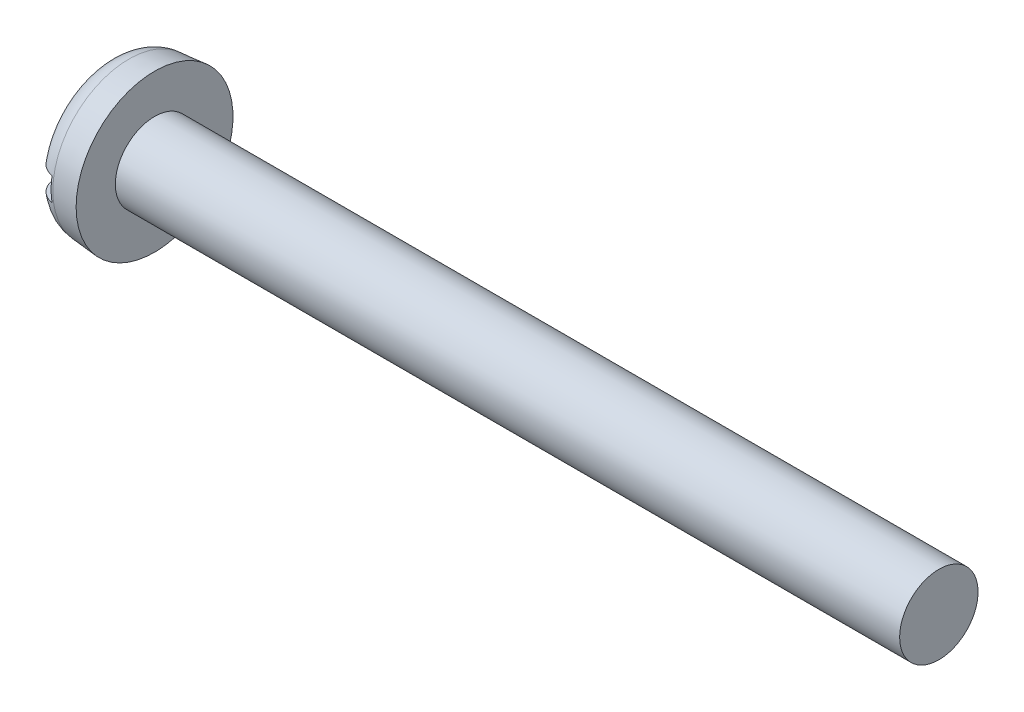
from build123d import *

# Parameters (mm, degrees)
FILLET2_R  = 1.2
SKETCH2_W  = 8
SKETCH2_H  = 1.2
SLOT_DEPTH = 1


with BuildPart() as part:
    # BodySke → Base-Revolve (revolve)
    with BuildSketch(Plane.XY):
        Polygon((2.4, 2), (2.4, 4), (0, 3.790027208), (0, 0), (42.4, 0), (42.4, 2), align=None)
    revolve(axis=Axis((-25.4, 0, 0), (1, 0, 0)))

    # Fillet2
    fillet2_edges = [part.edges().sort_by_distance(p)[0] for p in [
        (0, -3.790027208, 0),
    ]]
    fillet(fillet2_edges, radius=FILLET2_R)

    # Sketch2 → Slot (cut)
    with BuildSketch(Plane(origin=(0, 0, 0), x_dir=(0, 0, -1), z_dir=(1, 0, 0))):
        Rectangle(SKETCH2_W, SKETCH2_H)
    extrude(amount=SLOT_DEPTH, mode=Mode.SUBTRACT)


solid = part.part
